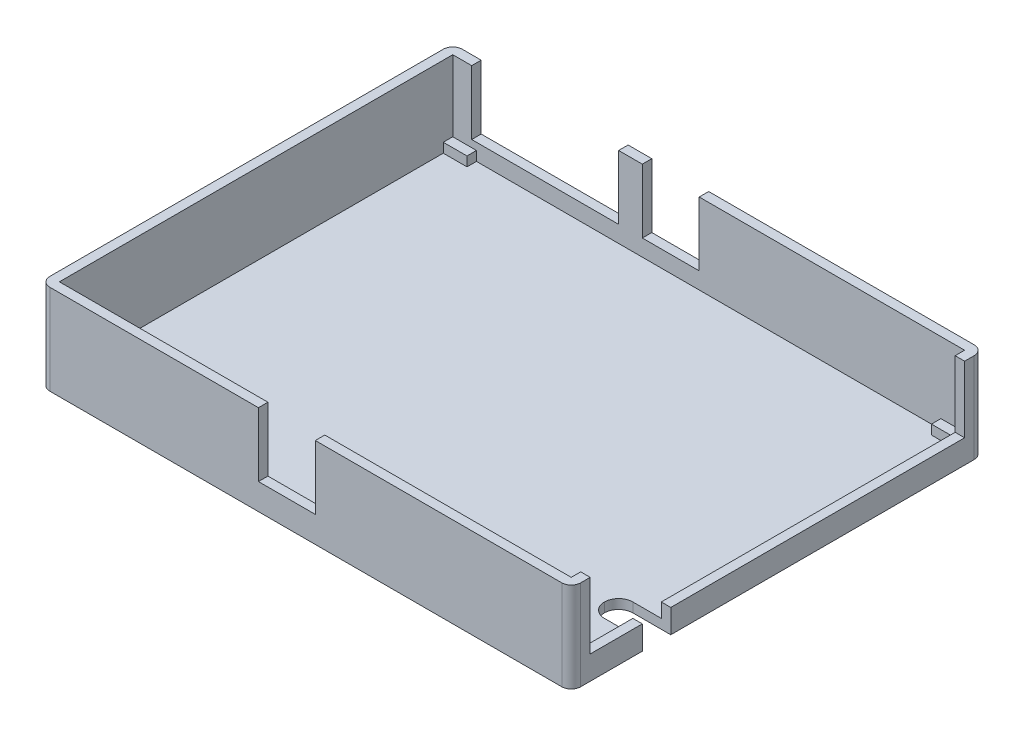
from build123d import *

# Parameters (mm, degrees)
SKETCH1_W           = 112
SKETCH1_H           = 87
BOSS_EXTRUDE1_DEPTH = 19
SKETCH3_W           = 108
SKETCH3_H           = 83
CUT_EXTRUDE1_DEPTH  = 17
SKETCH4_W           = 5
SKETCH4_H           = 2
BOSS_EXTRUDE3_DEPTH = 2
SKETCH5_W           = 5
SKETCH5_H           = 2
BOSS_EXTRUDE4_DEPTH = 2
SKETCH6_W           = 5
SKETCH6_H           = 2
BOSS_EXTRUDE5_DEPTH = 2
SKETCH7_W           = 5
SKETCH7_H           = 2
BOSS_EXTRUDE6_DEPTH = 2
SKETCH8_W           = 12
SKETCH8_H           = 13.5
CUT_EXTRUDE2_DEPTH  = 2
SKETCH9_W           = 31
SKETCH9_H           = 13.5
CUT_EXTRUDE3_DEPTH  = 2
SKETCH10_W          = 12
SKETCH10_H          = 13.5
CUT_EXTRUDE4_DEPTH  = 2
FILLET2_R           = 2
FILLET3_R           = 2
FILLET4_R           = 2
FILLET5_R           = 2
SKETCH11_W          = 0.314102564
SKETCH11_H          = 2.557692308
CUT_EXTRUDE5_DEPTH  = 0.5
SKETCH13_W          = 79
SKETCH13_H          = 14
CUT_EXTRUDE6_DEPTH  = 2
SKETCH14_W          = 6
SKETCH14_H          = 5
CUT_EXTRUDE8_DEPTH  = 11
FILLET6_R           = 3


with BuildPart() as part:
    # Sketch1 → Boss-Extrude1 (new body)
    with BuildSketch(Plane(origin=(0, 0, 0), x_dir=(1, 0, 0), z_dir=(0, 1, 0))):
        with Locations((-56, 43.5)):
            Rectangle(SKETCH1_W, SKETCH1_H)
    extrude(amount=BOSS_EXTRUDE1_DEPTH)

    # Sketch3 → Cut-Extrude1 (cut)
    with BuildSketch(Plane(origin=(0, 19, 0), x_dir=(1, 0, 0), z_dir=(0, 1, 0))):
        with Locations((-56, 43.5)):
            Rectangle(SKETCH3_W, SKETCH3_H)
    extrude(amount=-CUT_EXTRUDE1_DEPTH, mode=Mode.SUBTRACT)

    # Sketch4 → Boss-Extrude3 (add)
    with BuildSketch(Plane(origin=(0, 2, 0), x_dir=(1, 0, 0), z_dir=(0, 1, 0))):
        with Locations((-107.5, 84)):
            Rectangle(SKETCH4_W, SKETCH4_H)
    extrude(amount=BOSS_EXTRUDE3_DEPTH)

    # Sketch5 → Boss-Extrude4 (add)
    with BuildSketch(Plane(origin=(0, 2, 0), x_dir=(1, 0, 0), z_dir=(0, 1, 0))):
        with Locations((-4.5, 84)):
            Rectangle(SKETCH5_W, SKETCH5_H)
    extrude(amount=BOSS_EXTRUDE4_DEPTH)

    # Sketch6 → Boss-Extrude5 (add)
    with BuildSketch(Plane(origin=(0, 2, 0), x_dir=(1, 0, 0), z_dir=(0, 1, 0))):
        with Locations((-107.5, 3)):
            Rectangle(SKETCH6_W, SKETCH6_H)
    extrude(amount=BOSS_EXTRUDE5_DEPTH)

    # Sketch7 → Boss-Extrude6 (add)
    with BuildSketch(Plane(origin=(0, 2, 0), x_dir=(1, 0, 0), z_dir=(0, 1, 0))):
        with Locations((-4.5, 3)):
            Rectangle(SKETCH7_W, SKETCH7_H)
    extrude(amount=BOSS_EXTRUDE6_DEPTH)

    # Sketch8 → Cut-Extrude2 (cut)
    with BuildSketch(Plane.XY):
        with Locations((-60, 12.25)):
            Rectangle(SKETCH8_W, SKETCH8_H)
    extrude(amount=-CUT_EXTRUDE2_DEPTH, mode=Mode.SUBTRACT)

    # Sketch9 → Cut-Extrude3 (cut)
    with BuildSketch(Plane(origin=(0, 0, -87), x_dir=(-1, 0, 0), z_dir=(0, 0, -1))):
        with Locations((90.5, 12.25)):
            Rectangle(SKETCH9_W, SKETCH9_H)
    extrude(amount=-CUT_EXTRUDE3_DEPTH, mode=Mode.SUBTRACT)

    # Sketch10 → Cut-Extrude4 (cut)
    with BuildSketch(Plane(origin=(0, 0, -87), x_dir=(-1, 0, 0), z_dir=(0, 0, -1))):
        with Locations((64, 12.25)):
            Rectangle(SKETCH10_W, SKETCH10_H)
    extrude(amount=-CUT_EXTRUDE4_DEPTH, mode=Mode.SUBTRACT)

    # Fillet2
    fillet2_edges = [part.edges().sort_by_distance(p)[0] for p in [
        (-112, 9.5, 0),
    ]]
    fillet(fillet2_edges, radius=FILLET2_R)

    # Fillet3
    fillet3_edges = [part.edges().sort_by_distance(p)[0] for p in [
        (0, 9.5, 0),
    ]]
    fillet(fillet3_edges, radius=FILLET3_R)

    # Fillet4
    fillet4_edges = [part.edges().sort_by_distance(p)[0] for p in [
        (0, 9.5, -87),
    ]]
    fillet(fillet4_edges, radius=FILLET4_R)

    # Fillet5
    fillet5_edges = [part.edges().sort_by_distance(p)[0] for p in [
        (-112, 9.5, -87),
    ]]
    fillet(fillet5_edges, radius=FILLET5_R)

    # Sketch11 → Cut-Extrude5 (cut)
    # profile 1 of 9: a face of its own
    with BuildSketch(Plane(origin=(0, 2, 0), x_dir=(1, 0, 0), z_dir=(0, 1, 0))):
        Polygon((-36.173713221, 7.144580339), (-35.711673958, 10.644580339), (-35.666802163, 10.644580339), (-34.221790144, 7.772785467), (-32.780283734, 10.644580339), (-32.734710817, 10.644580339), (-32.269867067, 7.144580339), (-32.585371875, 7.144580339), (-32.920508093, 9.663009826), (-34.183929567, 7.144580339), (-34.254742868, 7.144580339), (-35.523072195, 9.6686188), (-35.857507292, 7.144580339), align=None)
    # profile 2 of 9: a face of its own
    with BuildSketch(Plane(origin=(0, 2, 0), x_dir=(1, 0, 0), z_dir=(0, 1, 0))):
        with BuildLine():
            add(Edge.make_bspline(
                [(-31.530884695, 10.779195723), (-31.51139338, 10.778291571), (-31.47322564, 10.776521067), (-31.418032372, 10.76135959), (-31.36777536, 10.735659904), (-31.323197627, 10.701180224), (-31.28494574, 10.66063078), (-31.25816503, 10.613369812), (-31.240952634, 10.562311173), (-31.238874079, 10.526696084), (-31.237815785, 10.508562711)],
                knots=[0, 0, 0, 0, 1.055194115, 2.066272739, 3.074728998, 4.095836921, 5.109056067, 6.073838105, 7.019297344, 8, 8, 8, 8], degree=3))
            add(Edge.make_bspline(
                [(-31.237815785, 10.508562711), (-31.238897945, 10.490900057), (-31.241037247, 10.455983082), (-31.258151735, 10.40580961), (-31.285173973, 10.359205327), (-31.323173099, 10.318734617), (-31.36778186, 10.284273997), (-31.418030645, 10.258569258), (-31.473226094, 10.24340912), (-31.511393533, 10.241638432), (-31.530884695, 10.240734185)],
                knots=[0, 0, 0, 0, 0.96129708, 1.900370562, 2.859976407, 3.87933698, 4.906634145, 5.921202961, 6.938410037, 8, 8, 8, 8], degree=3))
            add(Edge.make_bspline(
                [(-31.530884695, 10.240734185), (-31.550152971, 10.241603905), (-31.587656151, 10.243296702), (-31.642022993, 10.25886672), (-31.691851482, 10.284282793), (-31.736516155, 10.318508978), (-31.773746348, 10.359453875), (-31.800844674, 10.405781169), (-31.817919636, 10.455990324), (-31.820064264, 10.49090249), (-31.821149118, 10.508562711)],
                knots=[0, 0, 0, 0, 1.054934014, 2.053291228, 3.073705704, 4.106921865, 5.123545215, 6.088680038, 7.033164197, 8, 8, 8, 8], degree=3))
            add(Edge.make_bspline(
                [(-31.821149118, 10.508562711), (-31.820088032, 10.52669356), (-31.818003991, 10.562303693), (-31.800831875, 10.613398726), (-31.773972067, 10.660380228), (-31.736491503, 10.701405727), (-31.691858043, 10.735651162), (-31.642021298, 10.761062143), (-31.587656599, 10.776633483), (-31.550153123, 10.778326097), (-31.530884695, 10.779195723)],
                knots=[0, 0, 0, 0, 0.98631895, 1.937192651, 2.907499808, 3.917963147, 4.944918757, 5.95915025, 6.951458133, 8, 8, 8, 8], degree=3))
        make_face()
    # profile 3 of 9: a face of its own
    with BuildSketch(Plane(origin=(0, 2, 0), x_dir=(1, 0, 0), z_dir=(0, 1, 0))):
        with Locations((-31.529482452, 8.423426493)):
            Rectangle(SKETCH11_W, SKETCH11_H)
    # profile 4 of 9: a face of its own
    with BuildSketch(Plane(origin=(0, 2, 0), x_dir=(1, 0, 0), z_dir=(0, 1, 0))):
        with BuildLine():
            Line((-28.096790144, 9.147685307), (-28.359710817, 8.984323929))
            add(Edge.make_bspline(
                [(-28.359710817, 8.984323929), (-28.388540683, 9.020152322), (-28.445287378, 9.090674433), (-28.543826614, 9.181684366), (-28.648838028, 9.259851408), (-28.762116076, 9.323555159), (-28.883501876, 9.372776609), (-29.012516727, 9.407606815), (-29.149142232, 9.429311057), (-29.242807431, 9.431777894), (-29.290800561, 9.433041877)],
                knots=[0, 0, 0, 0, 1.026593902, 2.0206758, 2.988051866, 3.946915611, 4.916868779, 5.907761954, 6.927957743, 8, 8, 8, 8], degree=3))
            add(Edge.make_bspline(
                [(-29.290800561, 9.433041877), (-29.329159518, 9.431985035), (-29.40470644, 9.429903613), (-29.515612594, 9.41689312), (-29.621254947, 9.393251111), (-29.722295656, 9.362100155), (-29.818016074, 9.320349865), (-29.908666993, 9.269540109), (-29.995052483, 9.210490068), (-30.074669224, 9.142079523), (-30.147498231, 9.067680855), (-30.210597145, 8.98792716), (-30.265534078, 8.905207269), (-30.308640035, 8.817455527), (-30.343915205, 8.726679473), (-30.367121925, 8.631165618), (-30.382586621, 8.53213761), (-30.384355949, 8.46461927), (-30.385251683, 8.430437711)],
                knots=[0, 0, 0, 0, 1.112346261, 2.190735716, 3.231507886, 4.247384806, 5.251966152, 6.253067467, 7.256802811, 8.280671706, 9.291813951, 10.270744147, 11.225547591, 12.165006084, 13.100104208, 14.043489273, 15.009504848, 16, 16, 16, 16], degree=3))
            add(Edge.make_bspline(
                [(-30.385251683, 8.430437711), (-30.38347243, 8.3856685), (-30.3799379, 8.296733304), (-30.35223644, 8.165455202), (-30.306892033, 8.038531512), (-30.244834182, 7.916863375), (-30.166357048, 7.804269219), (-30.074184484, 7.703285765), (-29.968265401, 7.615869737), (-29.84953307, 7.543397212), (-29.720775327, 7.485135844), (-29.583385222, 7.443628511), (-29.438485442, 7.418576139), (-29.339278695, 7.415420195), (-29.288697195, 7.413811108)],
                knots=[0, 0, 0, 0, 0.966302908, 1.919585723, 2.883856336, 3.870342332, 4.860282998, 5.839159637, 6.814385684, 7.815993281, 8.834850808, 9.858348828, 10.908058873, 12, 12, 12, 12], degree=3))
            add(Edge.make_bspline(
                [(-29.288697195, 7.413811108), (-29.242342011, 7.415110605), (-29.151241773, 7.417664462), (-29.018074488, 7.439193425), (-28.891294577, 7.474437059), (-28.770906546, 7.523584709), (-28.65713038, 7.587112225), (-28.550701205, 7.665471396), (-28.449501267, 7.756407996), (-28.39000429, 7.826725967), (-28.359710817, 7.862529057)],
                knots=[0, 0, 0, 0, 1.039848629, 2.043578496, 3.018386758, 3.987534228, 4.954977003, 5.934852016, 6.948509513, 8, 8, 8, 8], degree=3))
            Line((-28.359710817, 7.862529057), (-28.096790144, 7.690053095))
            add(Edge.make_bspline(
                [(-28.096790144, 7.690053095), (-28.112377846, 7.667162368), (-28.143501513, 7.621456892), (-28.195529139, 7.557012775), (-28.25164897, 7.496691093), (-28.311642067, 7.440572703), (-28.374725077, 7.387314683), (-28.443052987, 7.339463109), (-28.514422598, 7.294328286), (-28.589671756, 7.253715414), (-28.668022454, 7.217209092), (-28.749364443, 7.185817922), (-28.833344256, 7.158847816), (-28.920060632, 7.137410469), (-29.009684531, 7.120299631), (-29.101984165, 7.108945929), (-29.196927747, 7.100470648), (-29.261099898, 7.099964781), (-29.293605048, 7.099708544)],
                knots=[0, 0, 0, 0, 0.954134338, 1.905101784, 2.851144739, 3.791306361, 4.734911809, 5.6936923, 6.663572882, 7.643865596, 8.638447847, 9.640600242, 10.646758161, 11.676244097, 12.717260333, 13.78922464, 14.880174919, 16, 16, 16, 16], degree=3))
            add(Edge.make_bspline(
                [(-29.293605048, 7.099708544), (-29.343215932, 7.100599824), (-29.440453624, 7.102346739), (-29.582776131, 7.121555214), (-29.718789799, 7.15051283), (-29.848448157, 7.192076564), (-29.971771391, 7.245581339), (-30.088644509, 7.310938254), (-30.198680527, 7.388690044), (-30.30079131, 7.477452813), (-30.394572756, 7.573693454), (-30.475098946, 7.677543372), (-30.544944217, 7.78518442), (-30.60103176, 7.898993946), (-30.645678687, 8.017459319), (-30.676183519, 8.141529559), (-30.695913257, 8.270181813), (-30.698196636, 8.357914695), (-30.699354247, 8.402392839)],
                knots=[0, 0, 0, 0, 1.1129367, 2.181364009, 3.217532258, 4.231199276, 5.232079859, 6.230262199, 7.231623845, 8.250719726, 9.263571943, 10.242672461, 11.195837495, 12.138959767, 13.085126421, 14.0317438, 15.002148558, 16, 16, 16, 16], degree=3))
            add(Edge.make_bspline(
                [(-30.699354247, 8.402392839), (-30.698913231, 8.432571273), (-30.698035977, 8.492601161), (-30.687974049, 8.581696227), (-30.674975576, 8.669604773), (-30.652949839, 8.755212492), (-30.627509207, 8.839817782), (-30.595033675, 8.922400883), (-30.556938281, 9.003345556), (-30.513686333, 9.082443286), (-30.464997588, 9.158392825), (-30.411116355, 9.23014649), (-30.354072019, 9.298566256), (-30.291195907, 9.361290016), (-30.225156253, 9.420826207), (-30.154084677, 9.475584332), (-30.078388825, 9.525725323), (-29.999205503, 9.572176338), (-29.916580791, 9.613535773), (-29.831014121, 9.649169011), (-29.743021092, 9.679621587), (-29.652460948, 9.703730506), (-29.559934775, 9.72394793), (-29.464713437, 9.736665776), (-29.367161214, 9.745652049), (-29.301105192, 9.746642841), (-29.267663542, 9.747144441)],
                knots=[0, 0, 0, 0, 0.990994727, 1.971252077, 2.943264845, 3.907940874, 4.872158414, 5.844625996, 6.82015047, 7.809835459, 8.804511986, 9.781214284, 10.756496977, 11.728388426, 12.696359165, 13.676225489, 14.672885716, 15.677705647, 16.690706858, 17.706033469, 18.721040654, 19.747369689, 20.783475414, 21.830280724, 22.901553713, 24, 24, 24, 24], degree=3))
            add(Edge.make_bspline(
                [(-29.267663542, 9.747144441), (-29.225783433, 9.74622255), (-29.142232554, 9.744383376), (-29.018291847, 9.728904724), (-28.896176653, 9.705568308), (-28.77802955, 9.670995478), (-28.665283035, 9.629131822), (-28.559747585, 9.582119108), (-28.463907481, 9.527524504), (-28.375979892, 9.46780439), (-28.295800375, 9.400443484), (-28.222545882, 9.324636527), (-28.154714233, 9.240778048), (-28.116257522, 9.178972316), (-28.096790144, 9.147685307)],
                knots=[0, 0, 0, 0, 1.095225653, 2.184976855, 3.262915854, 4.344593502, 5.400796181, 6.407717688, 7.363229445, 8.282371371, 9.184954523, 10.097238608, 11.036792983, 12, 12, 12, 12], degree=3))
        make_face()
    # profile 5 of 9: a face of its own
    with BuildSketch(Plane(origin=(0, 2, 0), x_dir=(1, 0, 0), z_dir=(0, 1, 0))):
        with BuildLine():
            Line((-27.558328606, 9.702272647), (-27.244226042, 9.702272647))
            Line((-27.244226042, 9.702272647), (-27.244226042, 9.325770243))
            add(Edge.make_bspline(
                [(-27.244226042, 9.325770243), (-27.221037283, 9.360826071), (-27.176688962, 9.42787007), (-27.102976032, 9.516539371), (-27.027472701, 9.589954418), (-26.949817514, 9.648457937), (-26.869439414, 9.692271055), (-26.788102462, 9.724364091), (-26.704526992, 9.743341406), (-26.648365068, 9.745875065), (-26.620227644, 9.747144441)],
                knots=[0, 0, 0, 0, 1.2804753, 2.448899062, 3.506932113, 4.484331642, 5.4025378, 6.288909075, 7.142734305, 8, 8, 8, 8], degree=3))
            add(Edge.make_bspline(
                [(-26.620227644, 9.747144441), (-26.598401318, 9.745953915), (-26.553492232, 9.743504329), (-26.485509643, 9.726293504), (-26.415466191, 9.698815482), (-26.370323803, 9.672975259), (-26.346790144, 9.659504217)],
                knots=[0, 0, 0, 0, 0.901110191, 1.854092781, 2.881294221, 4, 4, 4, 4], degree=3))
            Line((-26.346790144, 9.659504217), (-26.519266106, 9.387468961))
            add(Edge.make_bspline(
                [(-26.519266106, 9.387468961), (-26.534375127, 9.394209227), (-26.563054941, 9.407003542), (-26.605009508, 9.422145552), (-26.643690844, 9.431061468), (-26.668334403, 9.432412186), (-26.679822997, 9.433041877)],
                knots=[0, 0, 0, 0, 1.180555205, 2.24091978, 3.179933427, 4, 4, 4, 4], degree=3))
            add(Edge.make_bspline(
                [(-26.679822997, 9.433041877), (-26.70502873, 9.43136184), (-26.75644112, 9.427935051), (-26.83192562, 9.400996243), (-26.905172825, 9.357471003), (-26.963344487, 9.309199891), (-27.00838674, 9.262652093), (-27.040526966, 9.222003691), (-27.070009713, 9.176425059), (-27.098179933, 9.126695376), (-27.123846227, 9.07196553), (-27.147800897, 9.012782316), (-27.169459759, 8.949077187), (-27.181810004, 8.904694667), (-27.188136298, 8.881960147)],
                knots=[0, 0, 0, 0, 1.125678352, 2.296057538, 3.5422874, 4.923748041, 5.663163013, 6.437101912, 7.23742474, 8.08941207, 8.991984279, 9.93940061, 10.944477711, 12, 12, 12, 12], degree=3))
            add(Edge.make_bspline(
                [(-27.188136298, 8.881960147), (-27.192868691, 8.861682973), (-27.203350583, 8.816770574), (-27.213542121, 8.74142205), (-27.223611639, 8.652398391), (-27.230708257, 8.549451798), (-27.237286299, 8.432839354), (-27.240996382, 8.302383408), (-27.244099522, 8.157950057), (-27.244182589, 8.056975704), (-27.244226042, 8.004155659)],
                knots=[0, 0, 0, 0, 0.566838948, 1.255505196, 2.06880316, 3.007127437, 4.065329342, 5.249902469, 6.561414163, 8, 8, 8, 8], degree=3))
            Line((-27.244226042, 8.004155659), (-27.244226042, 7.144580339))
            Line((-27.244226042, 7.144580339), (-27.558328606, 7.144580339))
            Line((-27.558328606, 7.144580339), (-27.558328606, 9.702272647))
        make_face()
    # profile 6 of 9: a face of its own
    with BuildSketch(Plane(origin=(0, 2, 0), x_dir=(1, 0, 0), z_dir=(0, 1, 0))):
        with BuildLine():
            add(Edge.make_bspline(
                [(-24.797310977, 9.747144441), (-24.749319705, 9.74612255), (-24.655220547, 9.744118871), (-24.517412661, 9.722703906), (-24.385867525, 9.689956541), (-24.260081333, 9.644684979), (-24.141665038, 9.584003029), (-24.028893793, 9.511593738), (-23.922076785, 9.425811144), (-23.858053755, 9.359453076), (-23.82555617, 9.325770243)],
                knots=[0, 0, 0, 0, 1.054011418, 2.066658804, 3.057071809, 4.030435133, 4.997543892, 5.974964718, 6.972108034, 8, 8, 8, 8], degree=3))
            add(Edge.make_bspline(
                [(-23.82555617, 9.325770243), (-23.797574216, 9.293556257), (-23.742151835, 9.229751715), (-23.671086117, 9.126296102), (-23.609864556, 9.019156001), (-23.560801595, 8.906908674), (-23.522116572, 8.790534003), (-23.494650876, 8.669631992), (-23.478313941, 8.544469645), (-23.476110974, 8.459465807), (-23.474995272, 8.416415275)],
                knots=[0, 0, 0, 0, 1.025258237, 2.030674902, 3.01204498, 3.988269485, 4.97094183, 5.956517959, 6.965070386, 8, 8, 8, 8], degree=3))
            add(Edge.make_bspline(
                [(-23.474995272, 8.416415275), (-23.47597661, 8.373115217), (-23.477915778, 8.287552284), (-23.496259394, 8.161532918), (-23.52479048, 8.039338095), (-23.565622318, 7.921479401), (-23.617980428, 7.807596574), (-23.681871115, 7.698187025), (-23.757742732, 7.593034892), (-23.843746729, 7.493033053), (-23.938798605, 7.400866838), (-24.041914754, 7.320538569), (-24.151068787, 7.251717045), (-24.267712141, 7.196280629), (-24.390779627, 7.152570929), (-24.520536696, 7.121870912), (-24.656781766, 7.103309228), (-24.749808987, 7.100925655), (-24.797310977, 7.099708544)],
                knots=[0, 0, 0, 0, 0.998656419, 1.973391657, 2.932242238, 3.890759089, 4.846373663, 5.82037756, 6.809684879, 7.83454468, 8.860553229, 9.859544525, 10.845671541, 11.83227036, 12.833544569, 13.85385346, 14.904124723, 16, 16, 16, 16], degree=3))
            add(Edge.make_bspline(
                [(-24.797310977, 7.099708544), (-24.845045697, 7.10092974), (-24.938536557, 7.103321515), (-25.075262539, 7.121798797), (-25.205252158, 7.15255678), (-25.328480756, 7.196424273), (-25.445625603, 7.251718816), (-25.5554121, 7.320330506), (-25.658612015, 7.400890661), (-25.753684, 7.493026598), (-25.839682605, 7.593036555), (-25.915555614, 7.698186593), (-25.97944594, 7.807596687), (-26.031804144, 7.921479371), (-26.072635956, 8.039338103), (-26.101167049, 8.161532916), (-26.119510664, 8.287552284), (-26.121449832, 8.373115217), (-26.12243117, 8.416415275)],
                knots=[0, 0, 0, 0, 1.099876186, 2.154163076, 3.173186993, 4.173200201, 5.163417411, 6.152872554, 7.150605724, 8.17532212, 9.198891216, 10.186952605, 11.159729845, 12.11414092, 13.071450619, 14.029093627, 15.002601286, 16, 16, 16, 16], degree=3))
            add(Edge.make_bspline(
                [(-26.12243117, 8.416415275), (-26.121307859, 8.459231821), (-26.119083898, 8.544001223), (-26.102763389, 8.668928284), (-26.075404832, 8.789625673), (-26.036673436, 8.905551149), (-25.987158245, 9.017306585), (-25.926796957, 9.124711416), (-25.855006325, 9.227699216), (-25.799804373, 9.291421296), (-25.771870272, 9.323666877)],
                knots=[0, 0, 0, 0, 1.031353054, 2.041901799, 3.029428768, 4.008703097, 4.981709435, 5.96992636, 6.972712378, 8, 8, 8, 8], degree=3))
            add(Edge.make_bspline(
                [(-25.771870272, 9.323666877), (-25.739421681, 9.357641817), (-25.675605817, 9.424459513), (-25.56825709, 9.509992037), (-25.455763269, 9.583908111), (-25.336038342, 9.643384326), (-25.210355484, 9.690222844), (-25.078136242, 9.722788359), (-24.939860726, 9.744041714), (-24.845301105, 9.746099892), (-24.797310977, 9.747144441)],
                knots=[0, 0, 0, 0, 1.027980169, 2.021703884, 2.998553061, 3.971491411, 4.943284454, 5.930300938, 6.949603206, 8, 8, 8, 8], degree=3))
        make_face()
        with BuildLine():
            add(Edge.make_bspline(
                [(-24.798713221, 9.433041877), (-24.832650832, 9.432077286), (-24.899649961, 9.430173003), (-24.998269546, 9.415689098), (-25.0932097, 9.392741594), (-25.184650544, 9.360137538), (-25.272283716, 9.318038639), (-25.356193119, 9.266330279), (-25.436625559, 9.205697322), (-25.512007622, 9.136234651), (-25.581189934, 9.060355656), (-25.641667911, 8.979507297), (-25.693093017, 8.895000951), (-25.735933176, 8.80674874), (-25.767840364, 8.713856326), (-25.791013387, 8.617375695), (-25.805483627, 8.517110278), (-25.807370006, 8.44894926), (-25.808328606, 8.414311909)],
                knots=[0, 0, 0, 0, 1.021534396, 2.016698045, 2.994645724, 3.958388632, 4.93408049, 5.916473867, 6.921342795, 7.962252576, 8.998418191, 10.008913653, 10.997312074, 11.973003931, 12.956656626, 13.948281152, 14.957379055, 16, 16, 16, 16], degree=3))
            add(Edge.make_bspline(
                [(-25.808328606, 8.414311909), (-25.806721782, 8.369559882), (-25.803532538, 8.280735477), (-25.777597301, 8.149924354), (-25.734211021, 8.024342502), (-25.675623742, 7.904726116), (-25.602217523, 7.794053838), (-25.515730456, 7.695382353), (-25.417090756, 7.610196542), (-25.307474256, 7.539515696), (-25.189119938, 7.483355941), (-25.063863617, 7.443556965), (-24.933222923, 7.417685273), (-24.843942191, 7.415113798), (-24.798713221, 7.413811108)],
                knots=[0, 0, 0, 0, 1.016792936, 2.018143844, 3.017858371, 4.030088057, 5.03801393, 6.028138512, 7.003788237, 7.991172063, 8.984598303, 9.972568034, 10.972917682, 12, 12, 12, 12], degree=3))
            add(Edge.make_bspline(
                [(-24.798713221, 7.413811108), (-24.753486852, 7.415121388), (-24.664211256, 7.417707845), (-24.533752079, 7.443426665), (-24.408838107, 7.483530326), (-24.29060672, 7.539452535), (-24.181040116, 7.61046495), (-24.081690995, 7.694901327), (-23.995942384, 7.794315179), (-23.922608779, 7.904872707), (-23.863062036, 8.02415706), (-23.819878835, 8.149947532), (-23.793881249, 8.280729574), (-23.79070042, 8.369557905), (-23.789097836, 8.414311909)],
                knots=[0, 0, 0, 0, 1.02726834, 2.027799167, 3.010890988, 4.004497153, 4.992059811, 5.971914811, 6.958719428, 7.966827853, 8.981595046, 9.981490638, 10.983022906, 12, 12, 12, 12], degree=3))
            add(Edge.make_bspline(
                [(-23.789097836, 8.414311909), (-23.790056106, 8.448949467), (-23.791941836, 8.517110893), (-23.8064168, 8.617373346), (-23.82957234, 8.713864943), (-23.861543957, 8.806716946), (-23.904197971, 8.895229451), (-23.956614764, 8.979259178), (-24.016845789, 9.060635724), (-24.08686291, 9.135989364), (-24.162166288, 9.205724401), (-24.242631326, 9.26635379), (-24.326416305, 9.317811386), (-24.413794887, 9.360497626), (-24.505247455, 9.392444967), (-24.600054584, 9.415821598), (-24.698253394, 9.430111795), (-24.765012437, 9.432058936), (-24.798713221, 9.433041877)],
                knots=[0, 0, 0, 0, 1.042956736, 2.052379634, 3.044323526, 4.02829302, 5.004299113, 5.996692471, 7.007513377, 8.048758398, 9.090003419, 10.095195979, 11.07790575, 12.047570684, 13.018257071, 13.989683339, 14.985167495, 16, 16, 16, 16], degree=3))
        make_face(mode=Mode.SUBTRACT)
    # profile 7 of 9: a face of its own
    with BuildSketch(Plane(origin=(0, 2, 0), x_dir=(1, 0, 0), z_dir=(0, 1, 0))):
        with BuildLine():
            Line((-22.757046554, 10.644580339), (-22.074153926, 10.644580339))
            add(Edge.make_bspline(
                [(-22.074153926, 10.644580339), (-22.040725448, 10.644404588), (-21.975932738, 10.64406394), (-21.881713296, 10.638780809), (-21.793464485, 10.631577139), (-21.711160713, 10.620147047), (-21.63484001, 10.60635527), (-21.564272373, 10.589653453), (-21.499682201, 10.56962684), (-21.422569464, 10.537780559), (-21.334648804, 10.49045739), (-21.239450411, 10.420528825), (-21.158046172, 10.334996362), (-21.087859854, 10.238513707), (-21.032058735, 10.132377935), (-20.991689437, 10.019118746), (-20.966131562, 9.900197004), (-20.963503128, 9.818553826), (-20.962174759, 9.777292679)],
                knots=[0, 0, 0, 0, 1.001505555, 1.941167018, 2.826882275, 3.653841531, 4.429895133, 5.150066043, 5.825578002, 6.45369114, 7.647487171, 8.808567382, 9.977351308, 11.170798116, 12.373658725, 13.556498008, 14.765093433, 16, 16, 16, 16], degree=3))
            add(Edge.make_bspline(
                [(-20.962174759, 9.777292679), (-20.963267978, 9.738640123), (-20.965416255, 9.662684206), (-20.985959015, 9.551590097), (-21.018119683, 9.445838878), (-21.062824932, 9.345816492), (-21.120926928, 9.253782879), (-21.189785247, 9.168995613), (-21.27286205, 9.095044556), (-21.33510529, 9.053701654), (-21.366722035, 9.032701332)],
                knots=[0, 0, 0, 0, 1.044552857, 2.05264487, 3.044412934, 4.028983338, 5.005914585, 5.980388656, 6.974128949, 8, 8, 8, 8], degree=3))
            add(Edge.make_bspline(
                [(-21.366722035, 9.032701332), (-21.326961608, 9.017436333), (-21.25089006, 8.988230609), (-21.146204048, 8.936595145), (-21.056009203, 8.880433035), (-20.979612057, 8.819101185), (-20.914274402, 8.752992374), (-20.85722146, 8.68113726), (-20.808540086, 8.602598502), (-20.766827163, 8.518194966), (-20.734278406, 8.428788498), (-20.709902502, 8.335217722), (-20.695935053, 8.237818167), (-20.693947412, 8.171532787), (-20.69294399, 8.138069922)],
                knots=[0, 0, 0, 0, 1.27268992, 2.434971085, 3.483601985, 4.442670788, 5.356604649, 6.2567628, 7.179492994, 8.113709626, 9.066344395, 10.018646069, 10.999752585, 12, 12, 12, 12], degree=3))
            add(Edge.make_bspline(
                [(-20.69294399, 8.138069922), (-20.693920836, 8.10390305), (-20.695842808, 8.036678772), (-20.71002278, 7.937923637), (-20.734031887, 7.843548691), (-20.767103033, 7.752943508), (-20.810265348, 7.666283374), (-20.862793312, 7.58347011), (-20.925424876, 7.505335779), (-20.995487745, 7.431012156), (-21.07474989, 7.364184369), (-21.160265645, 7.304668662), (-21.253111965, 7.2557226), (-21.351763959, 7.214606578), (-21.457328275, 7.18319938), (-21.569330883, 7.161226806), (-21.687675184, 7.146421769), (-21.768884936, 7.145204564), (-21.810532131, 7.144580339)],
                knots=[0, 0, 0, 0, 0.978564426, 1.925352924, 2.850884081, 3.763762016, 4.682927383, 5.618979971, 6.567305752, 7.547517671, 8.540179244, 9.531824382, 10.526200242, 11.540722885, 12.589160233, 13.674978461, 14.80764778, 16, 16, 16, 16], degree=3))
            Line((-21.810532131, 7.144580339), (-22.757046554, 7.144580339))
            Line((-22.757046554, 7.144580339), (-22.757046554, 10.644580339))
        make_face()
        with BuildLine():
            Line((-22.44294399, 10.28560598), (-22.44294399, 9.163811108))
            Line((-22.44294399, 9.163811108), (-22.23190633, 9.163811108))
            add(Edge.make_bspline(
                [(-22.23190633, 9.163811108), (-22.201057535, 9.164211031), (-22.141451375, 9.164983764), (-22.055131479, 9.167197281), (-21.975006461, 9.173395324), (-21.901214628, 9.179591586), (-21.833872184, 9.189666174), (-21.773128322, 9.201658297), (-21.718029725, 9.214341202), (-21.65449018, 9.235910689), (-21.582417231, 9.267788364), (-21.505584127, 9.3172602), (-21.437849657, 9.376184553), (-21.38065247, 9.444175515), (-21.333840999, 9.519041701), (-21.301327284, 9.599588581), (-21.27928, 9.683808713), (-21.277288468, 9.741626966), (-21.276277324, 9.770982582)],
                knots=[0, 0, 0, 0, 1.156816544, 2.235205308, 3.236616184, 4.169592532, 5.011045266, 5.787822928, 6.49130361, 7.128639758, 8.301311294, 9.436451833, 10.541879658, 11.654887649, 12.756523258, 13.837046038, 14.901820046, 16, 16, 16, 16], degree=3))
            add(Edge.make_bspline(
                [(-21.276277324, 9.770982582), (-21.276803504, 9.790408354), (-21.277835664, 9.828514126), (-21.286288966, 9.88406348), (-21.300656541, 9.936307233), (-21.319110834, 9.985961343), (-21.344899523, 10.031473193), (-21.375262986, 10.074416389), (-21.411948676, 10.113328507), (-21.453705989, 10.149698006), (-21.501714612, 10.181942534), (-21.555945904, 10.210183297), (-21.617133581, 10.232924073), (-21.684246436, 10.252840226), (-21.758317523, 10.26682852), (-21.838492077, 10.278481907), (-21.925426796, 10.284414649), (-21.985571898, 10.285200012), (-22.016661939, 10.28560598)],
                knots=[0, 0, 0, 0, 0.91205012, 1.789085906, 2.630437955, 3.453916878, 4.269457761, 5.079663411, 5.91843418, 6.774407191, 7.675494373, 8.627863946, 9.638891023, 10.736472738, 11.911756761, 13.175263542, 14.539845004, 16, 16, 16, 16], degree=3))
            Line((-22.016661939, 10.28560598), (-22.44294399, 10.28560598))
        make_face(mode=Mode.SUBTRACT)
        with BuildLine():
            Line((-22.44294399, 8.804836749), (-22.44294399, 7.503554698))
            Line((-22.44294399, 7.503554698), (-21.995628285, 7.503554698))
            add(Edge.make_bspline(
                [(-21.995628285, 7.503554698), (-21.963609359, 7.503938445), (-21.901897101, 7.504678068), (-21.812795871, 7.507092622), (-21.730212767, 7.512584898), (-21.654524631, 7.521230748), (-21.584914178, 7.530609197), (-21.522216475, 7.543220478), (-21.465923282, 7.557669438), (-21.400648974, 7.58000361), (-21.327145466, 7.614700081), (-21.247934609, 7.667014308), (-21.177508391, 7.729337616), (-21.117703132, 7.80146853), (-21.068690144, 7.879899857), (-21.033034688, 7.963045207), (-21.011043832, 8.049530734), (-21.008381662, 8.108497447), (-21.007046554, 8.138069922)],
                knots=[0, 0, 0, 0, 1.160039823, 2.235823828, 3.228722157, 4.157150951, 4.99529583, 5.772374946, 6.472645482, 7.099169577, 8.269452708, 9.405989375, 10.527446681, 11.663510218, 12.788923519, 13.866172445, 14.929861265, 16, 16, 16, 16], degree=3))
            add(Edge.make_bspline(
                [(-21.007046554, 8.138069922), (-21.007322659, 8.156563263), (-21.007870414, 8.193251644), (-21.016131029, 8.247167464), (-21.028144898, 8.299393337), (-21.043676332, 8.350071077), (-21.066295799, 8.398284454), (-21.092702344, 8.444987013), (-21.123663746, 8.490240493), (-21.171907912, 8.547452746), (-21.242079897, 8.613369759), (-21.341786672, 8.677907261), (-21.45515897, 8.729955068), (-21.537386463, 8.752054545), (-21.579863061, 8.763470563)],
                knots=[0, 0, 0, 0, 0.723448775, 1.435228256, 2.130040452, 2.821711965, 3.505591119, 4.210454504, 4.921174351, 5.648778258, 7.137944449, 8.670945889, 10.280296675, 12, 12, 12, 12], degree=3))
            add(Edge.make_bspline(
                [(-21.579863061, 8.763470563), (-21.596892157, 8.766925647), (-21.633814749, 8.774416982), (-21.694022329, 8.782324685), (-21.762758198, 8.789369745), (-21.840181076, 8.794580903), (-21.926388917, 8.799967446), (-22.021565835, 8.802062267), (-22.12532315, 8.804561528), (-22.197315522, 8.804742662), (-22.234710817, 8.804836749)],
                knots=[0, 0, 0, 0, 0.634451884, 1.375622551, 2.216452059, 3.157844607, 4.20941857, 5.370758133, 6.634282058, 8, 8, 8, 8], degree=3))
            Line((-22.234710817, 8.804836749), (-22.44294399, 8.804836749))
        make_face(mode=Mode.SUBTRACT)
    # profile 8 of 9: a face of its own
    with BuildSketch(Plane(origin=(0, 2, 0), x_dir=(1, 0, 0), z_dir=(0, 1, 0))):
        with BuildLine():
            add(Edge.make_bspline(
                [(-18.829362259, 9.747144441), (-18.781370987, 9.74612255), (-18.687271829, 9.744118871), (-18.549463943, 9.722703906), (-18.417918807, 9.689956541), (-18.292132615, 9.644684979), (-18.17371632, 9.584003029), (-18.060945076, 9.511593738), (-17.954128067, 9.425811144), (-17.890105037, 9.359453076), (-17.857607452, 9.325770243)],
                knots=[0, 0, 0, 0, 1.054011418, 2.066658804, 3.057071809, 4.030435133, 4.997543892, 5.974964718, 6.972108034, 8, 8, 8, 8], degree=3))
            add(Edge.make_bspline(
                [(-17.857607452, 9.325770243), (-17.829625498, 9.293556257), (-17.774203117, 9.229751715), (-17.703137399, 9.126296102), (-17.641915839, 9.019156001), (-17.592852878, 8.906908674), (-17.554167854, 8.790534003), (-17.526702158, 8.669631992), (-17.510365223, 8.544469645), (-17.508162256, 8.459465807), (-17.507046554, 8.416415275)],
                knots=[0, 0, 0, 0, 1.025258237, 2.030674902, 3.01204498, 3.988269485, 4.97094183, 5.956517959, 6.965070386, 8, 8, 8, 8], degree=3))
            add(Edge.make_bspline(
                [(-17.507046554, 8.416415275), (-17.508027892, 8.373115217), (-17.50996706, 8.287552284), (-17.528310676, 8.161532918), (-17.556841762, 8.039338095), (-17.5976736, 7.921479401), (-17.65003171, 7.807596574), (-17.713922397, 7.698187025), (-17.789794014, 7.593034892), (-17.875798011, 7.493033053), (-17.970849887, 7.400866838), (-18.073966036, 7.320538569), (-18.183120069, 7.251717045), (-18.299763423, 7.196280629), (-18.422830909, 7.152570929), (-18.552587978, 7.121870912), (-18.688833048, 7.103309228), (-18.781860269, 7.100925655), (-18.829362259, 7.099708544)],
                knots=[0, 0, 0, 0, 0.998656419, 1.973391657, 2.932242238, 3.890759089, 4.846373663, 5.82037756, 6.809684879, 7.83454468, 8.860553229, 9.859544525, 10.845671541, 11.83227036, 12.833544569, 13.85385346, 14.904124723, 16, 16, 16, 16], degree=3))
            add(Edge.make_bspline(
                [(-18.829362259, 7.099708544), (-18.877096979, 7.10092974), (-18.970587839, 7.103321515), (-19.107313821, 7.121798797), (-19.23730344, 7.15255678), (-19.360532038, 7.196424273), (-19.477676885, 7.251718816), (-19.587463382, 7.320330506), (-19.690663298, 7.400890661), (-19.785735282, 7.493026598), (-19.871733887, 7.593036555), (-19.947606896, 7.698186593), (-20.011497222, 7.807596687), (-20.063855426, 7.921479371), (-20.104687239, 8.039338103), (-20.133218331, 8.161532916), (-20.151561946, 8.287552284), (-20.153501114, 8.373115217), (-20.154482452, 8.416415275)],
                knots=[0, 0, 0, 0, 1.099876186, 2.154163076, 3.173186993, 4.173200201, 5.163417411, 6.152872554, 7.150605724, 8.17532212, 9.198891216, 10.186952605, 11.159729845, 12.11414092, 13.071450619, 14.029093627, 15.002601286, 16, 16, 16, 16], degree=3))
            add(Edge.make_bspline(
                [(-20.154482452, 8.416415275), (-20.153359141, 8.459231821), (-20.15113518, 8.544001223), (-20.134814671, 8.668928284), (-20.107456114, 8.789625673), (-20.068724718, 8.905551149), (-20.019209527, 9.017306585), (-19.958848239, 9.124711416), (-19.887057607, 9.227699216), (-19.831855655, 9.291421296), (-19.803921554, 9.323666877)],
                knots=[0, 0, 0, 0, 1.031353054, 2.041901799, 3.029428768, 4.008703097, 4.981709435, 5.96992636, 6.972712378, 8, 8, 8, 8], degree=3))
            add(Edge.make_bspline(
                [(-19.803921554, 9.323666877), (-19.771472963, 9.357641817), (-19.707657099, 9.424459513), (-19.600308372, 9.509992037), (-19.487814551, 9.583908111), (-19.368089624, 9.643384326), (-19.242406767, 9.690222844), (-19.110187524, 9.722788359), (-18.971912009, 9.744041714), (-18.877352387, 9.746099892), (-18.829362259, 9.747144441)],
                knots=[0, 0, 0, 0, 1.027980169, 2.021703884, 2.998553061, 3.971491411, 4.943284454, 5.930300938, 6.949603206, 8, 8, 8, 8], degree=3))
        make_face()
        with BuildLine():
            add(Edge.make_bspline(
                [(-18.830764503, 9.433041877), (-18.864702114, 9.432077286), (-18.931701243, 9.430173003), (-19.030320828, 9.415689098), (-19.125260982, 9.392741594), (-19.216701826, 9.360137538), (-19.304334998, 9.318038639), (-19.388244401, 9.266330279), (-19.468676841, 9.205697322), (-19.544058904, 9.136234651), (-19.613241216, 9.060355656), (-19.673719193, 8.979507297), (-19.725144299, 8.895000951), (-19.767984458, 8.80674874), (-19.799891646, 8.713856326), (-19.823064669, 8.617375695), (-19.837534909, 8.517110278), (-19.839421288, 8.44894926), (-19.840379888, 8.414311909)],
                knots=[0, 0, 0, 0, 1.021534396, 2.016698045, 2.994645724, 3.958388632, 4.93408049, 5.916473867, 6.921342795, 7.962252576, 8.998418191, 10.008913653, 10.997312074, 11.973003931, 12.956656626, 13.948281152, 14.957379055, 16, 16, 16, 16], degree=3))
            add(Edge.make_bspline(
                [(-19.840379888, 8.414311909), (-19.838773064, 8.369559882), (-19.83558382, 8.280735477), (-19.809648583, 8.149924354), (-19.766262303, 8.024342502), (-19.707675024, 7.904726116), (-19.634268805, 7.794053838), (-19.547781738, 7.695382353), (-19.449142038, 7.610196542), (-19.339525538, 7.539515696), (-19.22117122, 7.483355941), (-19.095914899, 7.443556965), (-18.965274205, 7.417685273), (-18.875993473, 7.415113798), (-18.830764503, 7.413811108)],
                knots=[0, 0, 0, 0, 1.016792936, 2.018143844, 3.017858371, 4.030088057, 5.03801393, 6.028138512, 7.003788237, 7.991172063, 8.984598303, 9.972568034, 10.972917682, 12, 12, 12, 12], degree=3))
            add(Edge.make_bspline(
                [(-18.830764503, 7.413811108), (-18.785538134, 7.415121388), (-18.696262538, 7.417707845), (-18.565803361, 7.443426665), (-18.440889389, 7.483530326), (-18.322658002, 7.539452535), (-18.213091399, 7.61046495), (-18.113742277, 7.694901327), (-18.027993666, 7.794315179), (-17.954660061, 7.904872707), (-17.895113318, 8.02415706), (-17.851930117, 8.149947532), (-17.825932531, 8.280729574), (-17.822751702, 8.369557905), (-17.821149118, 8.414311909)],
                knots=[0, 0, 0, 0, 1.02726834, 2.027799167, 3.010890988, 4.004497153, 4.992059811, 5.971914811, 6.958719428, 7.966827853, 8.981595046, 9.981490638, 10.983022906, 12, 12, 12, 12], degree=3))
            add(Edge.make_bspline(
                [(-17.821149118, 8.414311909), (-17.822107388, 8.448949467), (-17.823993118, 8.517110893), (-17.838468082, 8.617373346), (-17.861623622, 8.713864943), (-17.893595239, 8.806716946), (-17.936249253, 8.895229451), (-17.988666046, 8.979259178), (-18.048897071, 9.060635724), (-18.118914192, 9.135989364), (-18.19421757, 9.205724401), (-18.274682608, 9.26635379), (-18.358467587, 9.317811386), (-18.445846169, 9.360497626), (-18.537298737, 9.392444967), (-18.632105866, 9.415821598), (-18.730304676, 9.430111795), (-18.797063719, 9.432058936), (-18.830764503, 9.433041877)],
                knots=[0, 0, 0, 0, 1.042956736, 2.052379634, 3.044323526, 4.02829302, 5.004299113, 5.996692471, 7.007513377, 8.048758398, 9.090003419, 10.095195979, 11.07790575, 12.047570684, 13.018257071, 13.989683339, 14.985167495, 16, 16, 16, 16], degree=3))
        make_face(mode=Mode.SUBTRACT)
    # profile 9 of 9: a face of its own
    with BuildSketch(Plane(origin=(0, 2, 0), x_dir=(1, 0, 0), z_dir=(0, 1, 0))):
        Polygon((-17.1032004, 9.702272647), (-16.729502484, 9.702272647), (-16.071149118, 8.779596364), (-15.412795753, 9.702272647), (-15.039097836, 9.702272647), (-15.883949599, 8.518077935), (-14.904482452, 7.144580339), (-15.278180368, 7.144580339), (-16.071149118, 8.255858384), (-16.864117868, 7.144580339), (-17.237815785, 7.144580339), (-16.257647516, 8.518077935), align=None)
    extrude(amount=-CUT_EXTRUDE5_DEPTH, mode=Mode.SUBTRACT)

    # Sketch13 → Cut-Extrude6 (cut)
    with BuildSketch(Plane(origin=(0, 0, 0), x_dir=(0, 0, -1), z_dir=(1, 0, 0))):
        with Locations((43.5, 12)):
            Rectangle(SKETCH13_W, SKETCH13_H)
    extrude(amount=-CUT_EXTRUDE6_DEPTH, mode=Mode.SUBTRACT)

    # Sketch14 → Cut-Extrude8 (cut)
    with BuildSketch(Plane(origin=(0, 0, 0), x_dir=(0, 0, -1), z_dir=(1, 0, 0))):
        with Locations((18, 2.5)):
            Rectangle(SKETCH14_W, SKETCH14_H)
    extrude(amount=-CUT_EXTRUDE8_DEPTH, mode=Mode.SUBTRACT)

    # Fillet6
    fillet6_edges = [part.edges().sort_by_distance(p)[0] for p in [
        (-11, 1, -21),
        (-11, 1, -15),
    ]]
    fillet(fillet6_edges, radius=FILLET6_R - 0.0001)  # a hair under: the kernel refuses the full size


solid = part.part
